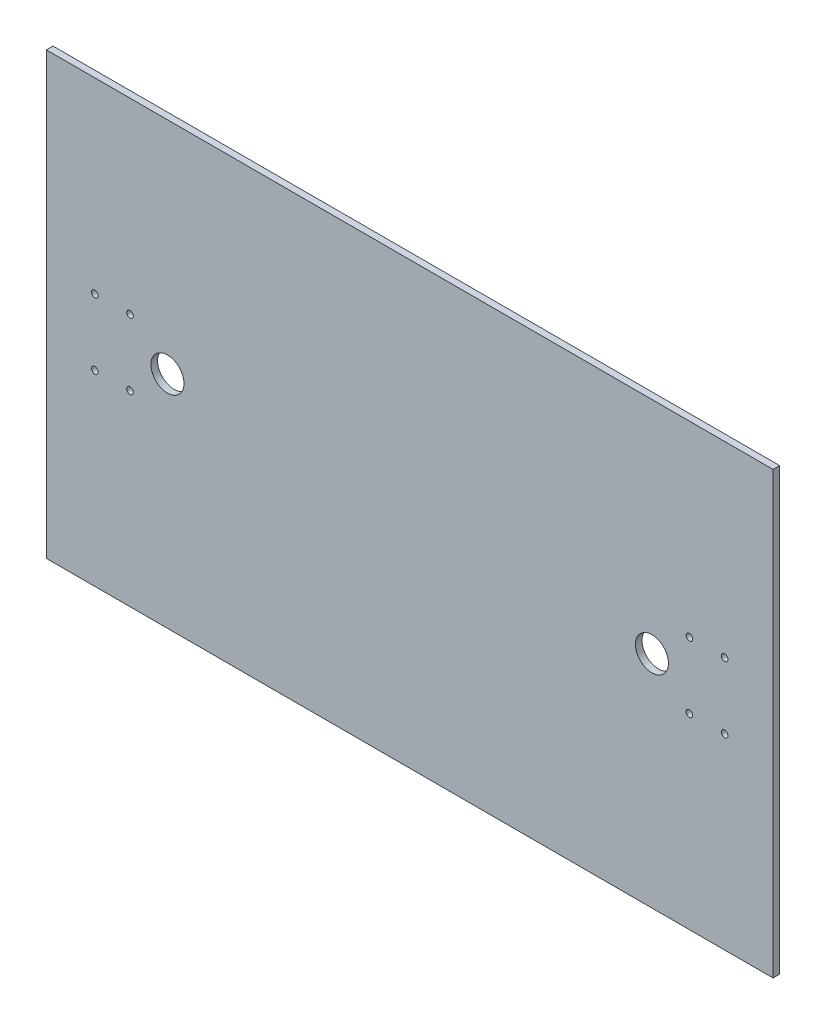
from build123d import *

# Parameters (mm, degrees)
CROQUIS1_W              = 330
CROQUIS1_H              = 200
SALIENTE_EXTRUIR1_DEPTH = 3
CROQUIS2_R              = 7.5
CROQUIS2_R_2            = 1.5
CORTAR_EXTRUIR1_DEPTH   = 193.961135983


with BuildPart() as part:
    # Croquis1 → Saliente-Extruir1 (new body)
    with BuildSketch(Plane.XY):
        Rectangle(CROQUIS1_W, CROQUIS1_H)
    extrude(amount=SALIENTE_EXTRUIR1_DEPTH)

    # Croquis2 → Cortar-Extruir1 (cut, through all)
    with BuildSketch(Plane.XY.offset(3)):
        with Locations((-110, 0)):
            Circle(CROQUIS2_R)
        with Locations((110, 0)):
            Circle(CROQUIS2_R)
        with Locations((-143, 15)):
            Circle(CROQUIS2_R_2)
        with Locations((-127, 15)):
            Circle(CROQUIS2_R_2)
        with Locations((-127, -15)):
            Circle(CROQUIS2_R_2)
        with Locations((-143, -15)):
            Circle(CROQUIS2_R_2)
        with Locations((127, 15)):
            Circle(CROQUIS2_R_2)
        with Locations((127, -15)):
            Circle(CROQUIS2_R_2)
        with Locations((143, -15)):
            Circle(CROQUIS2_R_2)
        with Locations((143, 15)):
            Circle(CROQUIS2_R_2)
    extrude(amount=-CORTAR_EXTRUIR1_DEPTH, mode=Mode.SUBTRACT)


solid = part.part
